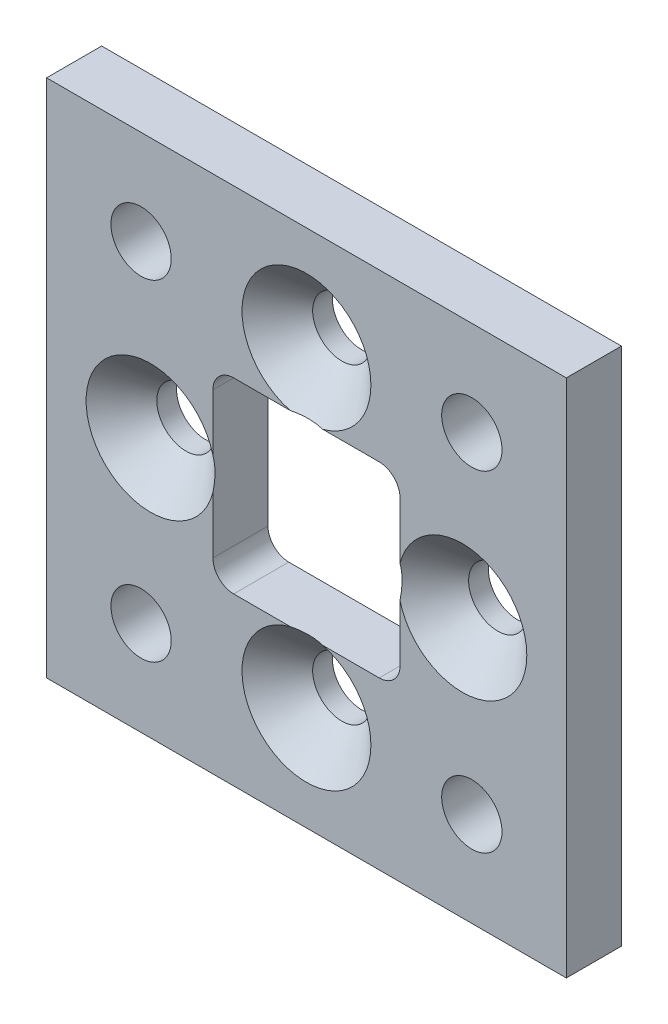
from build123d import *

# Parameters (mm, degrees)
SKETCH_1_W      = 25
SKETCH_1_H      = 25
SKETCH_1_R      = 1.4
SKETCH_1_R_2    = 1.45
SKETCH_1_W_2    = 9
SKETCH_1_H_2    = 9
EXTRUDE_1_DEPTH = 2.65
CHAMFER_1_SIZE  = 1.7
FILLET_1_R      = 1


with BuildPart() as part:
    # 草图1 → 凸台-拉伸1 (new body)
    with BuildSketch(Plane.XY):
        Rectangle(SKETCH_1_W, SKETCH_1_H)
        with Locations((0, 7.5)):
            Circle(SKETCH_1_R, mode=Mode.SUBTRACT)
        with Locations((7.5, 0)):
            Circle(SKETCH_1_R, mode=Mode.SUBTRACT)
        with Locations((0, -7.5)):
            Circle(SKETCH_1_R, mode=Mode.SUBTRACT)
        with Locations((-7.5, 0)):
            Circle(SKETCH_1_R, mode=Mode.SUBTRACT)
        with Locations((7.954951288, 7.954951288)):
            Circle(SKETCH_1_R_2, mode=Mode.SUBTRACT)
        with Locations((7.954951288, -7.954951288)):
            Circle(SKETCH_1_R_2, mode=Mode.SUBTRACT)
        with Locations((-7.954951288, -7.954951288)):
            Circle(SKETCH_1_R_2, mode=Mode.SUBTRACT)
        with Locations((-7.954951288, 7.954951288)):
            Circle(SKETCH_1_R_2, mode=Mode.SUBTRACT)
        Rectangle(SKETCH_1_W_2, SKETCH_1_H_2, mode=Mode.SUBTRACT)
    extrude(amount=EXTRUDE_1_DEPTH)

    # 倒角1
    # the kernel refuses this chamfer: 1.7 mm, written as the material it takes off along each edge
    with BuildSketch(Plane(origin=(0, 7.5, 2.65), x_dir=(1, 0, 0), z_dir=(0, -1, 0))) as chamfer_1_piece_1:
        Polygon((1.4, -CHAMFER_1_SIZE), (1.4 + CHAMFER_1_SIZE, 0), (1.4, 0), align=None)
    revolve(axis=Axis((0, 7.5, 2.65), (0, 0, 1)), mode=Mode.SUBTRACT)
    with BuildSketch(Plane(origin=(7.5, 0, 2.65), x_dir=(1, 0, 0), z_dir=(0, -1, 0))) as chamfer_1_piece_2:
        Polygon((1.4, -CHAMFER_1_SIZE), (1.4 + CHAMFER_1_SIZE, 0), (1.4, 0), align=None)
    revolve(axis=Axis((7.5, 0, 2.65), (0, 0, 1)), mode=Mode.SUBTRACT)
    with BuildSketch(Plane(origin=(0, -7.5, 2.65), x_dir=(1, 0, 0), z_dir=(0, -1, 0))) as chamfer_1_piece_3:
        Polygon((1.4, -CHAMFER_1_SIZE), (1.4 + CHAMFER_1_SIZE, 0), (1.4, 0), align=None)
    revolve(axis=Axis((0, -7.5, 2.65), (0, 0, 1)), mode=Mode.SUBTRACT)
    with BuildSketch(Plane(origin=(-7.5, 0, 2.65), x_dir=(1, 0, 0), z_dir=(0, -1, 0))) as chamfer_1_piece_4:
        Polygon((1.4, -CHAMFER_1_SIZE), (1.4 + CHAMFER_1_SIZE, 0), (1.4, 0), align=None)
    revolve(axis=Axis((-7.5, 0, 2.65), (0, 0, 1)), mode=Mode.SUBTRACT)

    # 圆角1
    fillet_1_edges = [part.edges().sort_by_distance(p)[0] for p in [
        (4.5, -4.5, 1.325),
        (4.5, 4.5, 1.325),
        (-4.5, 4.5, 1.325),
        (-4.5, -4.5, 1.325),
    ]]
    fillet(fillet_1_edges, radius=FILLET_1_R)


solid = part.part
